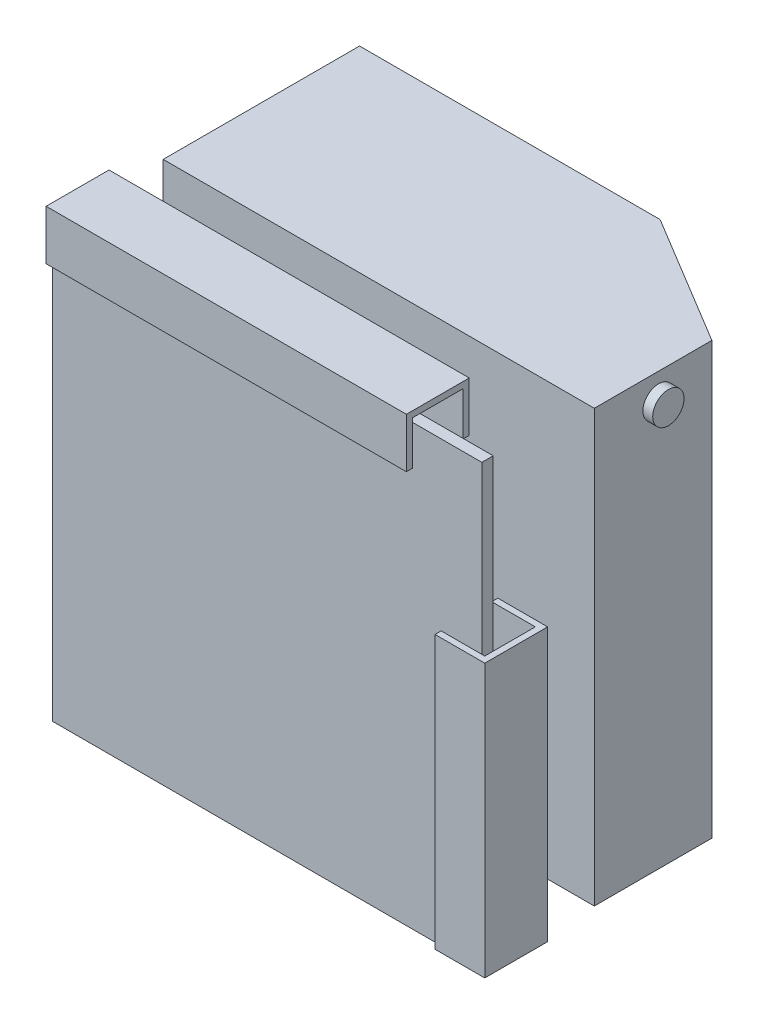
from build123d import *

# Parameters (mm, degrees)
HOUSING_DEPTH            = 55
DIFFUSER_SKETCH_W        = 109.6
DIFFUSER_SKETCH_H        = 112
DIFFUSER_DEPTH           = 1.45
SIDE_CHANNEL_DEPTH       = 34.785
END_CHANNEL_DEPTH        = 45.96
SIDE_SCREW_HEAD_SKETCH_R = 4
SIDE_SCREW_HEAD_DEPTH    = 1.75


with BuildPart() as part:
    # housing sketch → housing (new, symmetric)
    with BuildSketch(Plane(origin=(0, -55, 0), x_dir=(1, 0, 0), z_dir=(0, 1, 0))):
        Polygon((0, 0), (0, 30), (-33.304654329, 50.1), (-110, 50.1), (-110, 0), align=None)
    extrude(amount=HOUSING_DEPTH, both=True)

    # side screw head sketch → side screw head (add, symmetric)
    with BuildSketch(Plane(origin=(0.75, 0, 0), x_dir=(0, 0, -1), z_dir=(1, 0, 0))):
        with Locations((16.4, -6.8)):
            Circle(SIDE_SCREW_HEAD_SKETCH_R)
    extrude(amount=SIDE_SCREW_HEAD_DEPTH, both=True)

    # insert flange sketch → insert flange (revolve)
    with BuildSketch(Plane(origin=(0, -20.7, 0), x_dir=(1, 0, 0), z_dir=(0, 1, 0))):
        Polygon((-18.324853729, 39.891397061), (-17.291434706, 41.60371862), (-12.026045911, 38.425955124), (-13.059464934, 36.713633565), align=None)
    revolve(axis=Axis((-18.324853729, -20.7, -39.891397061), (0.5167095115681243, 0, -0.8561607796757748)))


with BuildPart() as body_2:
    # diffuser sketch → diffuser (new, symmetric)
    with BuildSketch(Plane.XY.offset(26.85)):
        with Locations((-55.2, -54)):
            Rectangle(DIFFUSER_SKETCH_W, DIFFUSER_SKETCH_H)
    extrude(amount=DIFFUSER_DEPTH, both=True)

    # side channel sketch → side channel (add, symmetric)
    with BuildSketch(Plane(origin=(0, -75.215, 0), x_dir=(1, 0, 0), z_dir=(0, 1, 0))):
        Polygon((-10.78, -13.83), (1.92, -13.83), (1.92, -29.87), (-10.78, -29.87), (-10.78, -28.3), (0.35, -28.3), (0.35, -15.4), (-10.78, -15.4), align=None)
    extrude(amount=SIDE_CHANNEL_DEPTH, both=True)

    # end channel sketch → end channel (add, symmetric)
    with BuildSketch(Plane(origin=(-64.04, 0, 0), x_dir=(0, 0, -1), z_dir=(1, 0, 0))):
        Polygon((-13.83, -8.13), (-13.83, 4.57), (-29.87, 4.57), (-29.87, -8.13), (-28.3, -8.13), (-28.3, 3), (-15.4, 3), (-15.4, -8.13), align=None)
    extrude(amount=END_CHANNEL_DEPTH, both=True)


solid = Compound([part.part, body_2.part])
